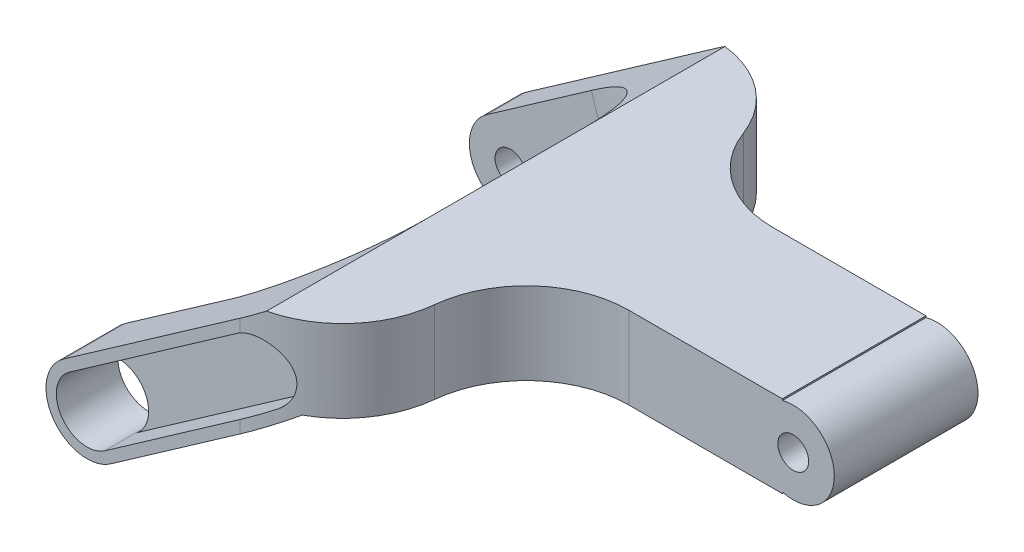
from build123d import *

# Parameters (mm, degrees)
SKETCH_1_R           = 1.5
EXTRUDE_2_DEPTH      = 50
SKETCH_14_W          = 30
SKETCH_14_H          = 18
CUT_EXTRUDE_6_DEPTH  = 65.195102675
SKETCH_15_W          = 22.4475894
SKETCH_15_H          = 16.25
CUT_EXTRUDE_7_DEPTH  = 30
SKETCH_17_W          = 25.359818697
SKETCH_17_H          = 19
CUT_EXTRUDE_9_DEPTH  = 30
FILLET_8_R           = 10
SKETCH_19_W          = 34.027540403
SKETCH_19_H          = 5
CUT_EXTRUDE_11_DEPTH = 65.759348106
FILLET_9_R           = 10
FILLET_11_R          = 10
FILLET_12_R          = 10
CUT_EXTRUDE_12_DEPTH = 3
CUT_EXTRUDE_START    = -5
SKETCH_21_R          = 3
CUT_EXTRUDE_13_DEPTH = 5


with BuildPart() as part:
    # 草图1 → 凸台-拉伸2 (new body)
    with BuildSketch(Plane.XY):
        with BuildLine():
            Line((15.60515688, 4.016530447), (15.60515688, 4.161375168))
            Line((15.60515688, 4.161375168), (-16.917233431, 4.161375168))
            Line((-16.917233431, 4.161375168), (-36.422020871, -9.496024029))
            ThreePointArc((-36.422020871, -9.496024029), (-37.404323302, -15.066937951), (-31.83340938, -16.049240383))
            Line((-31.83340938, -16.049240383), (-14.39484312, -3.838624832))
            Line((-14.39484312, -3.838624832), (15.60515688, -3.838624832))
            Line((15.60515688, -3.838624832), (15.60515688, -3.693780111))
            ThreePointArc((15.60515688, -3.693780111), (20.671823547, 0.161375168), (15.60515688, 4.016530447))
        make_face()
        with Locations((-34.127715125, -12.772632206)):
            Circle(SKETCH_1_R, mode=Mode.SUBTRACT)
        with Locations((16.671823547, 0.161375168)):
            Circle(SKETCH_1_R, mode=Mode.SUBTRACT)
    extrude(amount=EXTRUDE_2_DEPTH)

    # 草图14 → 切除-拉伸6 (cut, through all)
    with BuildSketch(Plane.XZ.offset(3.838624832)):
        with Locations((5.671823547, 41)):
            Rectangle(SKETCH_14_W, SKETCH_14_H)
        with Locations((5.671823547, 9)):
            Rectangle(SKETCH_14_W, SKETCH_14_H)
    extrude(amount=-CUT_EXTRUDE_6_DEPTH, mode=Mode.SUBTRACT)

    # 草图15 → 切除-拉伸7 (cut)
    with BuildSketch(Plane(origin=(0, 4.161375168, 0), x_dir=(1, 0, 0), z_dir=(0, 1, 0))):
        with Locations((-28.141028131, -16.875)):
            Rectangle(SKETCH_15_W, SKETCH_15_H)
    extrude(amount=-CUT_EXTRUDE_7_DEPTH, mode=Mode.SUBTRACT)

    # 草图17 → 切除-拉伸9 (cut)
    with BuildSketch(Plane(origin=(0, 4.161375168, 0), x_dir=(1, 0, 0), z_dir=(0, 1, 0))):
        with Locations((-29.59714278, -34.5)):
            Rectangle(SKETCH_17_W, SKETCH_17_H)
    extrude(amount=-CUT_EXTRUDE_9_DEPTH, mode=Mode.SUBTRACT)

    # 圆角8
    # the kernel refuses this fillet: 10 mm, written as the material it takes off along each edge
    with BuildSketch(Plane(origin=(-16.917233431, -5.604821542, 8.75), x_dir=(0.8191520442889905, 0.573576436351048, 0), z_dir=(0, 0, 1))) as fillet_8_piece_1:
        with BuildLine():
            CenterArc((13.012933373, 1.149926903), FILLET_8_R, 145, 41.603203435)
            Line((4.82141293, 6.885691266), (0, 0))
            Line((0, 0), (3.079269995, 0))
        make_face()
    extrude(amount=35.25, mode=Mode.SUBTRACT)

    # 草图19 → 切除-拉伸11 (cut, through all)
    with BuildSketch(Plane(origin=(-7.520806183, 10.740824359, 0), x_dir=(0.8191520442889908, 0.5735764363510477, 0), z_dir=(-0.5735764363510477, 0.8191520442889908, 0))):
        with Locations((-22.268098274, -2.5)):
            Rectangle(SKETCH_19_W, SKETCH_19_H)
    extrude(amount=-CUT_EXTRUDE_11_DEPTH, mode=Mode.SUBTRACT)

    # 圆角9
    fillet_9_edges = [part.edges().sort_by_distance(p)[0] for p in [
        (-9.328176453, 0.161375168, 18),
        (-9.328176453, 0.161375168, 32),
    ]]
    fillet(fillet_9_edges, radius=FILLET_9_R)

    # 圆角11
    # the kernel refuses this fillet: 10 mm, written as the material it adds along each edge
    with BuildSketch(Plane(origin=(-16.917233431, 29.161375168, 44), x_dir=(0, 0, -1), z_dir=(0, -1, 0))) as fillet_11_piece_1_section:
        with BuildLine():
            CenterArc((FILLET_11_R, -FILLET_11_R), FILLET_11_R, 90, 90)
            Line((0, -FILLET_11_R), (0, 0))
            Line((0, 0), (FILLET_11_R, 0))
        make_face()
    fillet_11_piece_1 = extrude(amount=26.360319786, mode=Mode.PRIVATE)
    fillet_11_piece_1 = split(fillet_11_piece_1, bisect_by=Plane(origin=(-17.705446038, 3.609462759, 40.498761656), z_dir=(0.5735764363510475, -0.8191520442889908, 0)), keep=Keep.TOP, mode=Mode.PRIVATE)
    add(fillet_11_piece_1)
    with BuildSketch(Plane(origin=(-16.917233431, 29.161375168, 8.75), x_dir=(-1, 0, 0), z_dir=(0, -1, 0))) as fillet_11_piece_2_section:
        with BuildLine():
            CenterArc((FILLET_11_R, -FILLET_11_R), FILLET_11_R, 90, 90)
            Line((0, -FILLET_11_R), (0, 0))
            Line((0, 0), (FILLET_11_R, 0))
        make_face()
    fillet_11_piece_2 = extrude(amount=26.360319786, mode=Mode.PRIVATE)
    fillet_11_piece_2 = split(fillet_11_piece_2, bisect_by=Plane(origin=(-17.705446038, 3.609462759, 12.251238344), z_dir=(0.5735764363510475, -0.8191520442889908, 0)), keep=Keep.TOP, mode=Mode.PRIVATE)
    add(fillet_11_piece_2)
    with BuildSketch(Plane(origin=(-6.917233431, 2.801055382, 8.75), x_dir=(-1, 0, 0), z_dir=(0, 1, 0))) as fillet_11_piece_3_section:
        with BuildLine():
            CenterArc((10 + FILLET_11_R, FILLET_11_R), FILLET_11_R, 180, 90)
            Line((10 + FILLET_11_R, 0), (10, 0))
            Line((10, 0), (10, FILLET_11_R))
        make_face()
    fillet_11_piece_3 = revolve(axis=Axis((-6.917233431, 2.801055382, 8.75), (0, 0, 1)), revolution_arc=184.854944875, mode=Mode.PRIVATE)
    fillet_11_piece_3 = split(fillet_11_piece_3, bisect_by=Plane(origin=(-14.201650521, -3.703349918, 18.374598869), z_dir=(-0.5735764363510472, 0.819152044288991, 0)), keep=Keep.TOP, mode=Mode.PRIVATE)
    fillet_11_piece_3 = split(fillet_11_piece_3, bisect_by=Plane(origin=(-18.790262012, 2.849866436, 18.374598869), z_dir=(0.5735764363510475, -0.8191520442889908, 0)), keep=Keep.TOP, mode=Mode.PRIVATE)
    add(fillet_11_piece_3)
    with BuildSketch(Plane(origin=(-6.917233431, 2.801055382, 44), x_dir=(-1, 0, 0), z_dir=(0, 1, 0))) as fillet_11_piece_4_section:
        with BuildLine():
            CenterArc((10 + FILLET_11_R, -FILLET_11_R), FILLET_11_R, 90, 90)
            Line((10 + FILLET_11_R, 0), (10, 0))
            Line((10, 0), (10, -FILLET_11_R))
        make_face()
    fillet_11_piece_4 = revolve(axis=Axis((-6.917233431, 2.801055382, 44), (0, 0, 1)), revolution_arc=184.854944875, mode=Mode.PRIVATE)
    fillet_11_piece_4 = split(fillet_11_piece_4, bisect_by=Plane(origin=(-14.743190126, -4.082540032, 40.444195091), z_dir=(-0.5735764363510472, 0.819152044288991, 0)), keep=Keep.TOP, mode=Mode.PRIVATE)
    fillet_11_piece_4 = split(fillet_11_piece_4, bisect_by=Plane(origin=(-19.331801617, 2.470676322, 40.444195091), z_dir=(0.5735764363510475, -0.8191520442889908, 0)), keep=Keep.TOP, mode=Mode.PRIVATE)
    add(fillet_11_piece_4)

    # 圆角12
    # the kernel refuses this fillet: 10 mm, written as the material it takes off along each edge
    with BuildSketch(Plane(origin=(-9.328176453, -28.587996687, 50), x_dir=(-1, 0, 0), z_dir=(0, 1, 0))) as fillet_12_piece_1:
        with BuildLine():
            CenterArc((9.899748742, -10), FILLET_12_R, 90, 84.260829523)
            Line((-0.050125629, -9), (-1.045113066, -8.9))
            ThreePointArc((-1.045113066, -8.9), (-1, -8), (-1, 0))
            Line((-1, 0), (0, 1))
            Line((0, 1), (9.899748742, 1))
            Line((9.899748742, 1), (9.899748742, 0))
        make_face()
    extrude(amount=57.498743711, mode=Mode.SUBTRACT)
    with BuildSketch(Plane(origin=(-9.328176453, -25.67610982, 5), x_dir=(-1, 0, 0), z_dir=(0, 1, 0))) as fillet_12_piece_2:
        with BuildLine():
            CenterArc((8.734993995, 10), FILLET_12_R, 200.487315115, 69.512684885)
            Line((-0.632503002, 6.5), (-1.569252702, 6.15))
            ThreePointArc((-1.569252702, 6.15), (-1, 3), (-1, 0))
            Line((-1, 0), (0, -1))
            Line((0, -1), (8.734993995, -1))
            Line((8.734993995, -1), (8.734993995, 0))
        make_face()
    extrude(amount=51.674969976, mode=Mode.SUBTRACT)

    # 草图20 → 切除-拉伸12 (cut)
    with BuildSketch(Plane.XY.offset(50)):
        with BuildLine():
            Line((-35.848444434, -10.315176073), (-19.465403549, 1.156352654))
            ThreePointArc((-19.465403549, 1.156352654), (-15.287218107, 0.41962583), (-16.02394493, -3.758559612))
            Line((-16.02394493, -3.758559612), (-32.406985816, -15.230088339))
            ThreePointArc((-32.406985816, -15.230088339), (-36.585171258, -14.493361515), (-35.848444434, -10.315176073))
        make_face()
    extrude(amount=-CUT_EXTRUDE_12_DEPTH, mode=Mode.SUBTRACT)

    # 草图21 → 切除-拉伸13 (cut)
    with BuildSketch(Plane(origin=(0, 0, 44), x_dir=(-1, 0, 0), z_dir=(0, 0, -1)).offset(CUT_EXTRUDE_START)):
        with Locations(Location((34.127715125, -12.772632206, 0), (0, 0, 235))):
            Circle(SKETCH_21_R)
    extrude(amount=CUT_EXTRUDE_13_DEPTH, mode=Mode.SUBTRACT)


solid = part.part
